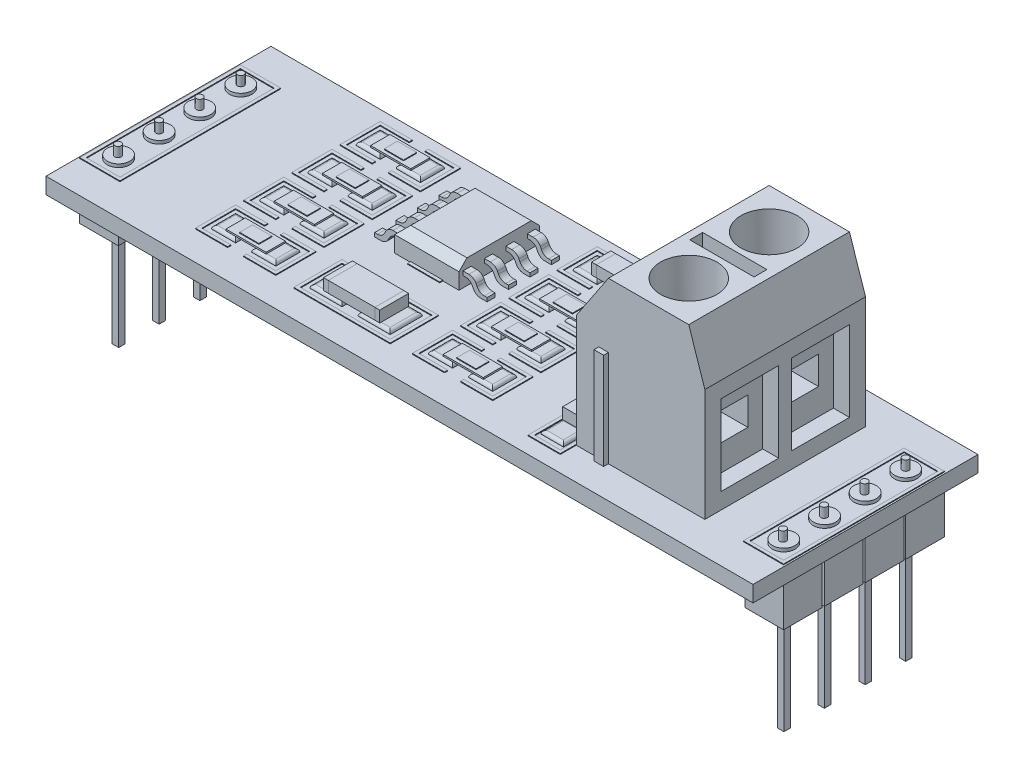
from build123d import *
from build123d.topology import SkipClean

# Parameters (mm, degrees)
SKETCH1_W              = 44
SKETCH1_H              = 14
BOSS_EXTRUDE1_DEPTH    = 1
SKETCH2_W              = 2.4
SKETCH2_H              = 2.4
BOSS_EXTRUDE2_DEPTH    = 2.5
SKETCH3_W              = 0.4
SKETCH3_H              = 0.4
BOSS_EXTRUDE3_DEPTH    = 6.5
SKETCH4_W              = 2.5
SKETCH4_H              = 10
SKETCH4_W_2            = 2.1
SKETCH4_H_2            = 9.6
SKETCH4_W_3            = 2
SKETCH4_H_3            = 5
SKETCH4_W_4            = 1.6
SKETCH4_H_4            = 4.6
SKETCH4_W_5            = 6
SKETCH4_H_5            = 3
SKETCH4_W_6            = 5.6
SKETCH4_H_6            = 2.6
SKETCH4_H_7            = 5.5
SKETCH4_H_8            = 5.1
BOSS_EXTRUDE4_DEPTH    = 0.05
SKETCH6_R              = 0.7
BOSS_EXTRUDE5_DEPTH    = 0.2
SKETCH8_R              = 0.2
BOSS_EXTRUDE6_DEPTH    = 0.6
SKETCH9_W              = 4
SKETCH9_H              = 5
BOSS_EXTRUDE7_DEPTH    = 1.5
CHAMFER1_SIZE          = 0.5
BOSS_EXTRUDE8_START    = -0.25
BOSS_EXTRUDE8_DEPTH    = 0.5
LPATTERN1_COUNT        = 4
LPATTERN1_PITCH        = 1.33333333
SKETCH11_W             = 1.5
SKETCH11_H             = 1.5
BOSS_EXTRUDE9_DEPTH    = 0.2
FILLET1_R              = 0.19
LPATTERN2_COUNT        = 4
LPATTERN2_PITCH        = 3
FILLET1_OF_LPATTERN2_R = 0.19
SKETCH12_W             = 2.5
SKETCH12_H             = 1.2
BOSS_EXTRUDE10_DEPTH   = 0.1
SKETCH13_W             = 1.2
SKETCH13_H             = 0.8
SKETCH13_H_2           = 0.834800421
SKETCH13_H_3           = 0.841380508
SKETCH13_H_4           = 0.817147306
BOSS_EXTRUDE11_DEPTH   = 0.05
SKETCH15_W             = 2
SKETCH15_H             = 2
SKETCH15_W_2           = 1.4
SKETCH15_H_2           = 1.4
BOSS_EXTRUDE12_DEPTH   = 0.2
FILLET2_R              = 0.19
SKETCH16_W             = 1.1
SKETCH16_H             = 2.5
BOSS_EXTRUDE13_DEPTH   = 0.1
SKETCH17_W             = 0.7
SKETCH17_H             = 1.2
BOSS_EXTRUDE14_DEPTH   = 0.05
SKETCH18_W             = 1.2
SKETCH18_H             = 1.5
BOSS_EXTRUDE15_DEPTH   = 0.7
SKETCH19_W             = 2.9
SKETCH19_H             = 1.8
BOSS_EXTRUDE16_DEPTH   = 0.7
BOSS_EXTRUDE17_DEPTH   = 0.3
BOSS_EXTRUDE18_DEPTH   = 0.3
SKETCH23_W             = 1.4
SKETCH23_H             = 1.2
BOSS_EXTRUDE19_DEPTH   = 0.7
BOSS_EXTRUDE20_DEPTH   = 0.3
BOSS_EXTRUDE21_DEPTH   = 0.3
BOSS_EXTRUDE22_START   = -2
BOSS_EXTRUDE22_DEPTH   = 10
SKETCH27_R             = 1.75
SKETCH27_W             = 4
SKETCH27_H             = 0.8
CUT_EXTRUDE1_DEPTH     = 3
SKETCH29_W             = 0.6
SKETCH29_H             = 6
BOSS_EXTRUDE23_DEPTH   = 0.3
SKETCH30_W             = 0.6
SKETCH30_H             = 6
CUT_EXTRUDE2_DEPTH     = 0.5
SKETCH31_W             = 3.6
SKETCH31_H             = 5
SKETCH31_W_2           = 1.75
SKETCH31_H_2           = 1.75
CUT_EXTRUDE3_DEPTH     = 1
SKETCH32_W             = 1.75
SKETCH32_H             = 1.75
CUT_EXTRUDE4_DEPTH     = 3
CUT_EXTRUDE5_DEPTH     = 1


with BuildPart() as part:
    # Sketch1 → Boss-Extrude1 (new body)
    with BuildSketch(Plane(origin=(0, 0, 0), x_dir=(1, 0, 0), z_dir=(0, 1, 0))):
        Rectangle(SKETCH1_W, SKETCH1_H)
    extrude(amount=BOSS_EXTRUDE1_DEPTH)

    # Sketch2 → Boss-Extrude2 (add)
    with BuildSketch(Plane.XZ):
        with Locations((20.7, -3.8)):
            Rectangle(SKETCH2_W, SKETCH2_H)
        with Locations((20.7, -1.28)):
            Rectangle(SKETCH2_W, SKETCH2_H)
        with Locations((20.7, 1.26)):
            Rectangle(SKETCH2_W, SKETCH2_H)
        with Locations((20.7, 3.8)):
            Rectangle(SKETCH2_W, SKETCH2_H)
        with Locations((-20.7, 3.8)):
            Rectangle(SKETCH2_W, SKETCH2_H)
        with Locations((-20.7, 1.26)):
            Rectangle(SKETCH2_W, SKETCH2_H)
        with Locations((-20.7, -1.28)):
            Rectangle(SKETCH2_W, SKETCH2_H)
        with Locations((-20.7, -3.8)):
            Rectangle(SKETCH2_W, SKETCH2_H)
    extrude(amount=BOSS_EXTRUDE2_DEPTH)

    # Sketch3 → Boss-Extrude3 (add)
    with BuildSketch(Plane.XZ.offset(2.5)):
        with Locations((-20.7, -1.28)):
            Rectangle(SKETCH3_W, SKETCH3_H)
        with Locations((-20.7, -3.8)):
            Rectangle(SKETCH3_W, SKETCH3_H)
        with Locations((-20.7, 3.78)):
            Rectangle(SKETCH3_W, SKETCH3_H)
        with Locations((-20.7, 1.26)):
            Rectangle(SKETCH3_W, SKETCH3_H)
        with Locations((20.7, -3.8)):
            Rectangle(SKETCH3_W, SKETCH3_H)
        with Locations((20.7, 1.26)):
            Rectangle(SKETCH3_W, SKETCH3_H)
        with Locations((20.7, -1.28)):
            Rectangle(SKETCH3_W, SKETCH3_H)
        with Locations((20.7, 3.78)):
            Rectangle(SKETCH3_W, SKETCH3_H)
    extrude(amount=BOSS_EXTRUDE3_DEPTH)

    # Sketch4 → Boss-Extrude4 (add)
    # profile 1 of 22: a face of its own
    with BuildSketch(Plane(origin=(0, 1, 0), x_dir=(1, 0, 0), z_dir=(0, 1, 0))):
        with Locations((20.65, 0)):
            Rectangle(SKETCH4_W, SKETCH4_H)
        with Locations((20.65, 0)):
            Rectangle(SKETCH4_W_2, SKETCH4_H_2, mode=Mode.SUBTRACT)
    # profile 2 of 22: a face of its own
    with BuildSketch(Plane(origin=(0, 1, 0), x_dir=(1, 0, 0), z_dir=(0, 1, 0))):
        with Locations((8, -3.5)):
            Rectangle(SKETCH4_W_3, SKETCH4_H_3)
        with Locations((8, -3.5)):
            Rectangle(SKETCH4_W_4, SKETCH4_H_4, mode=Mode.SUBTRACT)
    # profile 3 of 22: a face of its own
    with BuildSketch(Plane(origin=(0, 1, 0), x_dir=(1, 0, 0), z_dir=(0, 1, 0))):
        Polygon((9, 5.5), (7, 5.5), (7, 3.5), (7.2, 3.5), (7.2, 5.3), (8.8, 5.3), (8.8, 0.7), (7.2, 0.7), (7.2, 2.5), (7, 2.5), (7, 0.5), (9, 0.5), align=None)
    # profile 4 of 22: a face of its own
    with BuildSketch(Plane(origin=(0, 1, 0), x_dir=(1, 0, 0), z_dir=(0, 1, 0))):
        Polygon((4, -5.2), (4, -2.7), (2, -2.7), (2, -2.9), (3.8, -2.9), (3.8, -5), (2, -5), (2, -5.2), align=None)
    # profile 5 of 22: a face of its own
    with BuildSketch(Plane(origin=(0, 1, 0), x_dir=(1, 0, 0), z_dir=(0, 1, 0))):
        Polygon((4, -2.2), (4, 0.3), (2, 0.3), (2, 0.1), (3.8, 0.1), (3.8, -2), (2, -2), (2, -2.2), align=None)
    # profile 6 of 22: a face of its own
    with BuildSketch(Plane(origin=(0, 1, 0), x_dir=(1, 0, 0), z_dir=(0, 1, 0))):
        Polygon((2, 0.8), (4, 0.8), (4, 3.3), (2, 3.3), (2, 3.1), (3.8, 3.1), (3.8, 1), (2, 1), align=None)
    # profile 7 of 22: a face of its own
    with BuildSketch(Plane(origin=(0, 1, 0), x_dir=(1, 0, 0), z_dir=(0, 1, 0))):
        Polygon((4, 3.8), (4, 6.3), (2, 6.3), (2, 6.1), (3.8, 6.1), (3.8, 4), (2, 4), (2, 3.8), align=None)
    # profile 8 of 22: a face of its own
    with BuildSketch(Plane(origin=(0, 1, 0), x_dir=(1, 0, 0), z_dir=(0, 1, 0))):
        Polygon((-1, 3.8), (1, 3.8), (1, 4), (-0.8, 4), (-0.8, 6.1), (1, 6.1), (1, 6.3), (-1, 6.3), align=None)
    # profile 9 of 22: a face of its own
    with BuildSketch(Plane(origin=(0, 1, 0), x_dir=(1, 0, 0), z_dir=(0, 1, 0))):
        Polygon((1, 1), (-0.8, 1), (-0.8, 3.1), (1, 3.1), (1, 3.3), (-1, 3.3), (-1, 0.8), (1, 0.8), align=None)
    # profile 10 of 22: a face of its own
    with BuildSketch(Plane(origin=(0, 1, 0), x_dir=(1, 0, 0), z_dir=(0, 1, 0))):
        Polygon((-1, 0.3), (-1, -2.2), (1, -2.2), (1, -2), (-0.8, -2), (-0.8, 0.1), (1, 0.1), (1, 0.3), align=None)
    # profile 11 of 22: a face of its own
    with BuildSketch(Plane(origin=(0, 1, 0), x_dir=(1, 0, 0), z_dir=(0, 1, 0))):
        Polygon((1, -2.7), (-1, -2.7), (-1, -5.2), (1, -5.2), (1, -5), (-0.8, -5), (-0.8, -2.9), (1, -2.9), align=None)
    # profile 12 of 22: a face of its own
    with BuildSketch(Plane(origin=(0, 1, 0), x_dir=(1, 0, 0), z_dir=(0, 1, 0))):
        with Locations((-5.25, -3.830942692)):
            Rectangle(SKETCH4_W_5, SKETCH4_H_5)
        with Locations((-5.25, -3.830942692)):
            Rectangle(SKETCH4_W_6, SKETCH4_H_6, mode=Mode.SUBTRACT)
    # profile 13 of 22: a face of its own
    with BuildSketch(Plane(origin=(0, 1, 0), x_dir=(1, 0, 0), z_dir=(0, 1, 0))):
        Polygon((-9.5, 3.8), (-9.5, 6.3), (-11.5, 6.3), (-11.5, 6.1), (-9.7, 6.1), (-9.7, 4), (-11.5, 4), (-11.5, 3.8), align=None)
    # profile 14 of 22: a face of its own
    with BuildSketch(Plane(origin=(0, 1, 0), x_dir=(1, 0, 0), z_dir=(0, 1, 0))):
        Polygon((-9.5, 0.8), (-9.5, 3.3), (-11.5, 3.3), (-11.5, 3.1), (-9.7, 3.1), (-9.7, 1), (-11.5, 1), (-11.5, 0.8), align=None)
    # profile 15 of 22: a face of its own
    with BuildSketch(Plane(origin=(0, 1, 0), x_dir=(1, 0, 0), z_dir=(0, 1, 0))):
        Polygon((-9.5, -2.2), (-9.5, 0.3), (-11.5, 0.3), (-11.5, 0.1), (-9.7, 0.1), (-9.7, -2), (-11.5, -2), (-11.5, -2.2), align=None)
    # profile 16 of 22: a face of its own
    with BuildSketch(Plane(origin=(0, 1, 0), x_dir=(1, 0, 0), z_dir=(0, 1, 0))):
        Polygon((-9.5, -5.2), (-9.5, -2.7), (-11.5, -2.7), (-11.5, -2.9), (-9.7, -2.9), (-9.7, -5), (-11.5, -5), (-11.5, -5.2), align=None)
    # profile 17 of 22: a face of its own
    with BuildSketch(Plane(origin=(0, 1, 0), x_dir=(1, 0, 0), z_dir=(0, 1, 0))):
        Polygon((-14.5, -2.7), (-14.5, -5.2), (-12.5, -5.2), (-12.5, -5), (-14.3, -5), (-14.3, -2.9), (-12.5, -2.9), (-12.5, -2.7), align=None)
    # profile 18 of 22: a face of its own
    with BuildSketch(Plane(origin=(0, 1, 0), x_dir=(1, 0, 0), z_dir=(0, 1, 0))):
        Polygon((-14.5, 0.3), (-14.5, -2.2), (-12.5, -2.2), (-12.5, -2), (-14.3, -2), (-14.3, 0.1), (-12.5, 0.1), (-12.5, 0.3), align=None)
    # profile 19 of 22: a face of its own
    with BuildSketch(Plane(origin=(0, 1, 0), x_dir=(1, 0, 0), z_dir=(0, 1, 0))):
        Polygon((-14.5, 3.3), (-14.5, 0.8), (-12.5, 0.8), (-12.5, 1), (-14.3, 1), (-14.3, 3.1), (-12.5, 3.1), (-12.5, 3.3), align=None)
    # profile 20 of 22: a face of its own
    with BuildSketch(Plane(origin=(0, 1, 0), x_dir=(1, 0, 0), z_dir=(0, 1, 0))):
        Polygon((-14.5, 6.3), (-14.5, 3.8), (-12.5, 3.8), (-12.5, 4), (-14.3, 4), (-14.3, 6.1), (-12.5, 6.1), (-12.5, 6.3), align=None)
    # profile 21 of 22: a face of its own
    with BuildSketch(Plane(origin=(0, 1, 0), x_dir=(1, 0, 0), z_dir=(0, 1, 0))):
        with Locations((-20.65, 0)):
            Rectangle(SKETCH4_W, SKETCH4_H)
        with Locations((-20.65, 0)):
            Rectangle(SKETCH4_W_2, SKETCH4_H_2, mode=Mode.SUBTRACT)
    # profile 22 of 22: a face of its own
    with BuildSketch(Plane(origin=(0, 1, 0), x_dir=(1, 0, 0), z_dir=(0, 1, 0))):
        with Locations((-5, 2.25)):
            Rectangle(SKETCH4_W_3, SKETCH4_H_7)
        with Locations((-5, 2.25)):
            Rectangle(SKETCH4_W_4, SKETCH4_H_8, mode=Mode.SUBTRACT)
    extrude(amount=BOSS_EXTRUDE4_DEPTH)

    # Sketch6 → Boss-Extrude5 (add)
    with BuildSketch(Plane(origin=(0, 1, 0), x_dir=(1, 0, 0), z_dir=(0, 1, 0))):
        with Locations(Location((-20.7, -1.26, 0), (0, 0, 90))):
            Circle(SKETCH6_R)
        with Locations(Location((-20.7, 1.263175474, 0), (0, 0, 90))):
            Circle(SKETCH6_R)
        with Locations(Location((-20.7, 3.819776202, 0), (0, 0, 90))):
            Circle(SKETCH6_R)
        with Locations(Location((20.712260477, -3.8, 0), (0, 0, 90))):
            Circle(SKETCH6_R)
        with Locations(Location((20.712260477, -1.26, 0), (0, 0, 90))):
            Circle(SKETCH6_R)
        with Locations(Location((20.712260477, 1.263175474, 0), (0, 0, 90))):
            Circle(SKETCH6_R)
        with Locations(Location((-20.7, -3.783175474, 0), (0, 0, 90))):
            Circle(SKETCH6_R)
        with Locations(Location((20.712260477, 3.786350949, 0), (0, 0, 90))):
            Circle(SKETCH6_R)
    extrude(amount=BOSS_EXTRUDE5_DEPTH)

    # Sketch8 → Boss-Extrude6 (add)
    with BuildSketch(Plane(origin=(0, 1.2, 0), x_dir=(1, 0, 0), z_dir=(0, 1, 0))):
        with Locations(Location((-20.7, 3.819776202, 0), (0, 0, 270))):
            Circle(SKETCH8_R)
        with Locations(Location((-20.7, 1.263175474, 0), (0, 0, 270))):
            Circle(SKETCH8_R)
        with Locations(Location((-20.7, -3.816600728, 0), (0, 0, 270))):
            Circle(SKETCH8_R)
        with Locations(Location((-20.7, -1.26, 0), (0, 0, 270))):
            Circle(SKETCH8_R)
        with Locations(Location((20.712260477, 1.229750221, 0), (0, 0, 270))):
            Circle(SKETCH8_R)
        with Locations(Location((20.712260477, -1.293425253, 0), (0, 0, 270))):
            Circle(SKETCH8_R)
        with Locations(Location((20.712260477, 3.786350949, 0), (0, 0, 270))):
            Circle(SKETCH8_R)
        with Locations(Location((20.712260477, -3.850025981, 0), (0, 0, 270))):
            Circle(SKETCH8_R)
    extrude(amount=BOSS_EXTRUDE6_DEPTH)

    # Sketch9 → Boss-Extrude7 (add)
    with BuildSketch(Plane(origin=(0, 1, 0), x_dir=(1, 0, 0), z_dir=(0, 1, 0))):
        with Locations((-5, 2.2)):
            Rectangle(SKETCH9_W, SKETCH9_H)
    extrude(amount=BOSS_EXTRUDE7_DEPTH)

    # Chamfer1
    chamfer1_edges = [part.edges().sort_by_distance(p)[0] for p in [
        (-7, 2.5, -2.2),
        (-5, 2.5, 0.3),
        (-5, 2.5, -4.7),
    ]]
    chamfer(chamfer1_edges, length=CHAMFER1_SIZE)

    # Sketch10 → Boss-Extrude8 (add)
    with BuildSketch(Plane.XY.offset(0.3).offset(BOSS_EXTRUDE8_START)):
        with BuildLine():
            Line((-1.901151848, 1), (-1.5, 1))
            Line((-1.5, 1), (-1.5, 1.23576906))
            Line((-1.5, 1.23576906), (-1.673873459, 1.23576906))
            ThreePointArc((-1.673873459, 1.23576906), (-1.9384799, 1.311524518), (-2.122904812, 1.515835334))
            Line((-2.122904812, 1.515835334), (-2.184312687, 1.641209744))
            ThreePointArc((-2.184312687, 1.641209744), (-2.368737599, 1.845520561), (-2.63334404, 1.921276019))
            Line((-2.63334404, 1.921276019), (-3, 1.921276019))
            Line((-3, 1.921276019), (-3, 1.669904943))
            Line((-3, 1.669904943), (-2.852980626, 1.669904943))
            ThreePointArc((-2.852980626, 1.669904943), (-2.588374185, 1.594149485), (-2.403949272, 1.389838668))
            Line((-2.403949272, 1.389838668), (-2.350183202, 1.280066274))
            ThreePointArc((-2.350183202, 1.280066274), (-2.165758289, 1.075755458), (-1.901151848, 1))
        make_face()
        with BuildLine():
            Line((-8.326126541, 1.23576906), (-8.5, 1.23576906))
            Line((-8.5, 1.23576906), (-8.5, 1))
            Line((-8.5, 1), (-8.098848152, 1))
            ThreePointArc((-8.098848152, 1), (-7.834241711, 1.075755458), (-7.649816798, 1.280066274))
            Line((-7.649816798, 1.280066274), (-7.596050728, 1.389838668))
            ThreePointArc((-7.596050728, 1.389838668), (-7.411625815, 1.594149485), (-7.147019374, 1.669904943))
            Line((-7.147019374, 1.669904943), (-7, 1.669904943))
            Line((-7, 1.669904943), (-7, 1.921276019))
            Line((-7, 1.921276019), (-7.36665596, 1.921276019))
            ThreePointArc((-7.36665596, 1.921276019), (-7.631262401, 1.845520561), (-7.815687313, 1.641209744))
            Line((-7.815687313, 1.641209744), (-7.877095188, 1.515835334))
            ThreePointArc((-7.877095188, 1.515835334), (-8.0615201, 1.311524518), (-8.326126541, 1.23576906))
        make_face()
    boss_extrude8 = extrude(amount=-BOSS_EXTRUDE8_DEPTH)

    # LPattern1: Boss-Extrude8 ×4
    with Locations(*[(0, 0, -i * LPATTERN1_PITCH) for i in range(1, LPATTERN1_COUNT)]):
        add(boss_extrude8)

    # Sketch11 → Boss-Extrude9 (add)
    with BuildSketch(Plane(origin=(0, 1, 0), x_dir=(1, 0, 0), z_dir=(0, 1, 0))):
        with Locations((-13.25, 5.05)):
            Rectangle(SKETCH11_W, SKETCH11_H)
        with Locations((-10.75, 5.05)):
            Rectangle(SKETCH11_W, SKETCH11_H)
        with Locations((2.75, 5.05)):
            Rectangle(SKETCH11_W, SKETCH11_H)
        with Locations((0.25, 5.05)):
            Rectangle(SKETCH11_W, SKETCH11_H)
    boss_extrude9 = extrude(amount=BOSS_EXTRUDE9_DEPTH)

    # Fillet1
    fillet1_edges = [part.edges().sort_by_distance(p)[0] for p in [
        (-13.25, 1.2, -5.8),
        (-14, 1.2, -5.05),
        (-13.25, 1.2, -4.3),
        (-12.5, 1.2, -5.05),
        (-10.75, 1.2, -4.3),
        (-10, 1.2, -5.05),
        (-10.75, 1.2, -5.8),
        (-11.5, 1.2, -5.05),
        (0.25, 1.2, -5.8),
        (-0.5, 1.2, -5.05),
        (0.25, 1.2, -4.3),
        (1, 1.2, -5.05),
        (2, 1.2, -5.05),
        (2.75, 1.2, -4.3),
        (3.5, 1.2, -5.05),
        (2.75, 1.2, -5.8),
    ]]
    fillet(fillet1_edges, radius=FILLET1_R)

    # LPattern2: Boss-Extrude9 ×4
    with Locations(*[(0, 0, i * LPATTERN2_PITCH) for i in range(1, LPATTERN2_COUNT)]):
        add(boss_extrude9)

    # Fillet1 of LPattern2
    fillet1_of_lpattern2_edges = [part.edges().sort_by_distance(p)[0] for p in [
        (-13.25, 1.2, -2.8),
        (-14, 1.2, -2.05),
        (-13.25, 1.2, -1.3),
        (-12.5, 1.2, -2.05),
        (-10.75, 1.2, -1.3),
        (-10, 1.2, -2.05),
        (-10.75, 1.2, -2.8),
        (-11.5, 1.2, -2.05),
        (0.25, 1.2, -2.8),
        (-0.5, 1.2, -2.05),
        (0.25, 1.2, -1.3),
        (1, 1.2, -2.05),
        (2, 1.2, -2.05),
        (2.75, 1.2, -1.3),
        (3.5, 1.2, -2.05),
        (2.75, 1.2, -2.8),
        (-13.25, 1.2, 0.2),
        (-14, 1.2, 0.95),
        (-13.25, 1.2, 1.7),
        (-12.5, 1.2, 0.95),
        (-10.75, 1.2, 1.7),
        (-10, 1.2, 0.95),
        (-10.75, 1.2, 0.2),
        (-11.5, 1.2, 0.95),
        (0.25, 1.2, 0.2),
        (-0.5, 1.2, 0.95),
        (0.25, 1.2, 1.7),
        (1, 1.2, 0.95),
        (2, 1.2, 0.95),
        (2.75, 1.2, 1.7),
        (3.5, 1.2, 0.95),
        (2.75, 1.2, 0.2),
        (-13.25, 1.2, 3.2),
        (-14, 1.2, 3.95),
        (-13.25, 1.2, 4.7),
        (-12.5, 1.2, 3.95),
        (-10.75, 1.2, 4.7),
        (-10, 1.2, 3.95),
        (-10.75, 1.2, 3.2),
        (-11.5, 1.2, 3.95),
        (0.25, 1.2, 3.2),
        (-0.5, 1.2, 3.95),
        (0.25, 1.2, 4.7),
        (1, 1.2, 3.95),
        (2, 1.2, 3.95),
        (2.75, 1.2, 4.7),
        (3.5, 1.2, 3.95),
        (2.75, 1.2, 3.2),
    ]]
    fillet(fillet1_of_lpattern2_edges, radius=FILLET1_OF_LPATTERN2_R)

    # Sketch12 → Boss-Extrude10 (add)
    with BuildSketch(Plane(origin=(0, 1.2, 0), x_dir=(1, 0, 0), z_dir=(0, 1, 0))):
        with Locations((1.51088394, -3.95)):
            Rectangle(SKETCH12_W, SKETCH12_H)
        with Locations((1.51088394, -0.95)):
            Rectangle(SKETCH12_W, SKETCH12_H)
        with Locations((1.51088394, 2.05)):
            Rectangle(SKETCH12_W, SKETCH12_H)
        with Locations((-12, -3.95)):
            Rectangle(SKETCH12_W, SKETCH12_H)
        with Locations((-12, -0.95)):
            Rectangle(SKETCH12_W, SKETCH12_H)
        with Locations((-12, 2.05)):
            Rectangle(SKETCH12_W, SKETCH12_H)
        with Locations((-12, 5.05)):
            Rectangle(SKETCH12_W, SKETCH12_H)
    extrude(amount=BOSS_EXTRUDE10_DEPTH)

    # Sketch13 → Boss-Extrude11 (add)
    with BuildSketch(Plane(origin=(0, 1.3, 0), x_dir=(1, 0, 0), z_dir=(0, 1, 0))):
        with Locations((1.51088394, -3.95)):
            Rectangle(SKETCH13_W, SKETCH13_H)
        with Locations((1.51088394, -0.932599789)):
            Rectangle(SKETCH13_W, SKETCH13_H_2)
        with Locations((1.51088394, 2.070690254)):
            Rectangle(SKETCH13_W, SKETCH13_H_3)
        with Locations((-12, -3.95)):
            Rectangle(SKETCH13_W, SKETCH13_H)
        with Locations((-12, -0.932599789)):
            Rectangle(SKETCH13_W, SKETCH13_H_2)
        with Locations((-12, 2.070690254)):
            Rectangle(SKETCH13_W, SKETCH13_H_3)
        with Locations((-12, 5.058573653)):
            Rectangle(SKETCH13_W, SKETCH13_H_4)
    extrude(amount=BOSS_EXTRUDE11_DEPTH)

    # Sketch15 → Boss-Extrude12 (add)
    with BuildSketch(Plane(origin=(0, 1, 0), x_dir=(1, 0, 0), z_dir=(0, 1, 0))):
        with Locations((-3.75, -3.830942692)):
            Rectangle(SKETCH15_W, SKETCH15_H)
        with Locations((-6.75, -3.830942692)):
            Rectangle(SKETCH15_W, SKETCH15_H)
        with Locations((8, -4.8)):
            Rectangle(SKETCH15_W_2, SKETCH15_H_2)
        with Locations((8, -2.2)):
            Rectangle(SKETCH15_W_2, SKETCH15_H_2)
        with Locations((8, 1.7)):
            Rectangle(SKETCH15_W_2, SKETCH15_H_2)
        with Locations((8, 4.3)):
            Rectangle(SKETCH15_W_2, SKETCH15_H_2)
    extrude(amount=BOSS_EXTRUDE12_DEPTH)

    # Fillet2
    fillet2_edges = [part.edges().sort_by_distance(p)[0] for p in [
        (-4.75, 1.2, 3.830942692),
        (-3.75, 1.2, 2.830942692),
        (-2.75, 1.2, 3.830942692),
        (-3.75, 1.2, 4.830942692),
        (-6.75, 1.2, 4.830942692),
        (-7.75, 1.2, 3.830942692),
        (-6.75, 1.2, 2.830942692),
        (-5.75, 1.2, 3.830942692),
        (8, 1.2, 4.1),
        (8.7, 1.2, 4.8),
        (8, 1.2, 5.5),
        (7.3, 1.2, 4.8),
        (8, 1.2, -3.6),
        (7.3, 1.2, -4.3),
        (8, 1.2, -5),
        (8.7, 1.2, -4.3),
        (8, 1.2, 1.5),
        (8.7, 1.2, 2.2),
        (8, 1.2, 2.9),
        (7.3, 1.2, 2.2),
        (8, 1.2, -1),
        (7.3, 1.2, -1.7),
        (8, 1.2, -2.4),
        (8.7, 1.2, -1.7),
    ]]
    fillet(fillet2_edges, radius=FILLET2_R)

    # Sketch16 → Boss-Extrude13 (add)
    with BuildSketch(Plane(origin=(0, 1.2, 0), x_dir=(1, 0, 0), z_dir=(0, 1, 0))):
        with Locations((8, 3)):
            Rectangle(SKETCH16_W, SKETCH16_H)
    extrude(amount=BOSS_EXTRUDE13_DEPTH)

    # Sketch17 → Boss-Extrude14 (add)
    with BuildSketch(Plane(origin=(0, 1.3, 0), x_dir=(1, 0, 0), z_dir=(0, 1, 0))):
        with Locations((8, 3)):
            Rectangle(SKETCH17_W, SKETCH17_H)
    extrude(amount=BOSS_EXTRUDE14_DEPTH)

    # Sketch19 → Boss-Extrude16 (add)
    with BuildSketch(Plane(origin=(0, 1.2, 0), x_dir=(1, 0, 0), z_dir=(0, 1, 0))):
        with Locations((-5.25, -3.830942692)):
            Rectangle(SKETCH19_W, SKETCH19_H)
    extrude(amount=BOSS_EXTRUDE16_DEPTH)

    # Sketch23 → Boss-Extrude19 (add)
    with BuildSketch(Plane(origin=(0, 1.2, 0), x_dir=(1, 0, 0), z_dir=(0, 1, 0))):
        with Locations((1.5, 5.05)):
            Rectangle(SKETCH23_W, SKETCH23_H)
    extrude(amount=BOSS_EXTRUDE19_DEPTH)

    # Sketch26 → Boss-Extrude22 (add)
    with BuildSketch(Plane.XY.offset(7).offset(BOSS_EXTRUDE22_START)):
        Polygon((17, 1), (9, 1), (9, 8), (11, 11), (16, 11), (17, 8), align=None)
    extrude(amount=-BOSS_EXTRUDE22_DEPTH)

    # Sketch27 → Cut-Extrude1 (cut)
    with BuildSketch(Plane(origin=(0, 11, 0), x_dir=(1, 0, 0), z_dir=(0, 1, 0))):
        with Locations(Location((13.5, 2.5, 0), (0, 0, 180))):
            Circle(SKETCH27_R)
        with Locations(Location((13.5, -2.5, 0), (0, 0, 180))):
            Circle(SKETCH27_R)
        with Locations((13.46399843, 0)):
            Rectangle(SKETCH27_W, SKETCH27_H)
    extrude(amount=-CUT_EXTRUDE1_DEPTH, mode=Mode.SUBTRACT)

    # Sketch29 → Boss-Extrude23 (add)
    with BuildSketch(Plane.XY.offset(5)):
        with Locations((10.7, 4)):
            Rectangle(SKETCH29_W, SKETCH29_H)
    extrude(amount=BOSS_EXTRUDE23_DEPTH)

    # Sketch30 → Cut-Extrude2 (cut)
    with BuildSketch(Plane(origin=(0, 0, -5), x_dir=(-1, 0, 0), z_dir=(0, 0, -1))):
        with Locations((-10.7, 4)):
            Rectangle(SKETCH30_W, SKETCH30_H)
    extrude(amount=-CUT_EXTRUDE2_DEPTH, mode=Mode.SUBTRACT)

    # Sketch31 → Cut-Extrude3 (cut)
    # profile 1 of 2: a face of its own
    with BuildSketch(Plane(origin=(17, 0, 0), x_dir=(0, 0, -1), z_dir=(1, 0, 0))):
        with Locations((2.2, 4.5)):
            Rectangle(SKETCH31_W, SKETCH31_H)
        with Locations((2.2, 4.5)):
            Rectangle(SKETCH31_W_2, SKETCH31_H_2, mode=Mode.SUBTRACT)
    # profile 2 of 2: a face of its own
    with BuildSketch(Plane(origin=(17, 0, 0), x_dir=(0, 0, -1), z_dir=(1, 0, 0))):
        with Locations((-2.2, 4.5)):
            Rectangle(SKETCH31_W, SKETCH31_H)
        with Locations((-2.2, 4.5)):
            Rectangle(SKETCH31_W_2, SKETCH31_H_2, mode=Mode.SUBTRACT)
    extrude(amount=-CUT_EXTRUDE3_DEPTH, mode=Mode.SUBTRACT)

    # Sketch32 → Cut-Extrude4 (cut)
    with BuildSketch(Plane(origin=(17, 0, 0), x_dir=(0, 0, -1), z_dir=(1, 0, 0))):
        with Locations((2.2, 4.5)):
            Rectangle(SKETCH32_W, SKETCH32_H)
        with Locations((-2.2, 4.5)):
            Rectangle(SKETCH32_W, SKETCH32_H)
    extrude(amount=-CUT_EXTRUDE4_DEPTH, mode=Mode.SUBTRACT)

    # Sketch33 → Cut-Extrude5 (cut)
    with SkipClean():  # the faces are left unmerged after this step: merging them gives an invalid solid
        with BuildSketch(Plane(origin=(0, 8, 0), x_dir=(1, 0, 0), z_dir=(0, 1, 0))):
            with BuildLine():
                Line((11.774111845, -2.7894997), (15.225888155, -2.7894997))
                ThreePointArc((15.225888155, -2.7894997), (15.25, -2.5), (15.225888155, -2.2105003))
                Line((15.225888155, -2.2105003), (11.774111845, -2.2105003))
                ThreePointArc((11.774111845, -2.2105003), (11.75, -2.5), (11.774111845, -2.7894997))
            make_face()
            with BuildLine():
                Line((11.774111845, 2.7894997), (15.225888155, 2.7894997))
                ThreePointArc((15.225888155, 2.7894997), (15.25, 2.5), (15.225888155, 2.2105003))
                Line((15.225888155, 2.2105003), (11.774111845, 2.2105003))
                ThreePointArc((11.774111845, 2.2105003), (11.75, 2.5), (11.774111845, 2.7894997))
            make_face()
        extrude(amount=-CUT_EXTRUDE5_DEPTH, mode=Mode.SUBTRACT)


with BuildPart() as body_2:
    # Sketch18 → Boss-Extrude15 (new body)
    with BuildSketch(Plane(origin=(0, 1.2, 0), x_dir=(1, 0, 0), z_dir=(0, 1, 0))):
        with Locations((8, -3.49428049)):
            Rectangle(SKETCH18_W, SKETCH18_H)
    extrude(amount=BOSS_EXTRUDE15_DEPTH)


with BuildPart() as body_3:
    # Sketch21 → Boss-Extrude17 (new body)
    with BuildSketch(Plane.ZY.offset(6.7)):
        Polygon((2.930942692, 1.2), (3.020942692, 1.2), (4.640942692, 1.2), (4.730942692, 1.2), (4.730942692, 1.9), (2.930942692, 1.9), align=None)
    extrude(amount=BOSS_EXTRUDE17_DEPTH)


with BuildPart() as body_4:
    # Sketch22 → Boss-Extrude18 (new body)
    with BuildSketch(Plane(origin=(-3.8, 0, 0), x_dir=(0, 0, -1), z_dir=(1, 0, 0))):
        Polygon((-4.730942692, 1.2), (-4.640942692, 1.2), (-3.020942692, 1.2), (-2.930942692, 1.2), (-2.930942692, 1.9), (-4.730942692, 1.9), align=None)
    extrude(amount=BOSS_EXTRUDE18_DEPTH)


with BuildPart() as body_5:
    # Sketch24 → Boss-Extrude20 (new body)
    with BuildSketch(Plane.ZY.offset(-0.8)):
        Polygon((-5.65, 1.2), (-5.61, 1.2), (-4.49, 1.2), (-4.45, 1.2), (-4.45, 1.9), (-5.65, 1.9), align=None)
    extrude(amount=BOSS_EXTRUDE20_DEPTH)


with BuildPart() as body_6:
    # Sketch25 → Boss-Extrude21 (new body)
    with BuildSketch(Plane(origin=(2.2, 0, 0), x_dir=(0, 0, -1), z_dir=(1, 0, 0))):
        Polygon((4.45, 1.2), (4.49, 1.2), (5.61, 1.2), (5.65, 1.2), (5.65, 1.9), (4.45, 1.9), align=None)
    extrude(amount=BOSS_EXTRUDE21_DEPTH)


solid = Compound([part.part, body_2.part, body_3.part, body_4.part, body_5.part, body_6.part])
